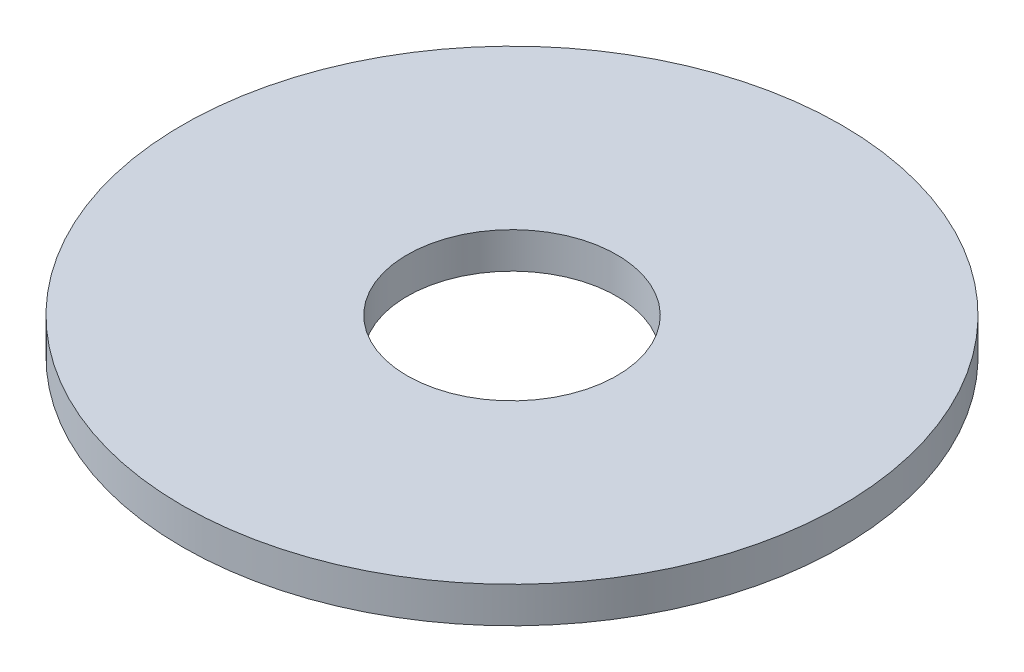
from build123d import *

# Parameters (mm, degrees)
SKETCH1_R           = 55
BOSS_EXTRUDE1_DEPTH = 6
SKETCH2_R           = 17.5
CUT_EXTRUDE1_DEPTH  = 79.012819459


with BuildPart() as part:
    # Sketch1 → Boss-Extrude1 (new body)
    with BuildSketch(Plane(origin=(0, 0, 0), x_dir=(1, 0, 0), z_dir=(0, 1, 0))):
        Circle(SKETCH1_R)
    extrude(amount=BOSS_EXTRUDE1_DEPTH)

    # Sketch2 → Cut-Extrude1 (cut, through all)
    with BuildSketch(Plane(origin=(0, 0, 0), x_dir=(1, 0, 0), z_dir=(0, 1, 0))):
        Circle(SKETCH2_R)
    extrude(amount=CUT_EXTRUDE1_DEPTH, mode=Mode.SUBTRACT)


solid = part.part
